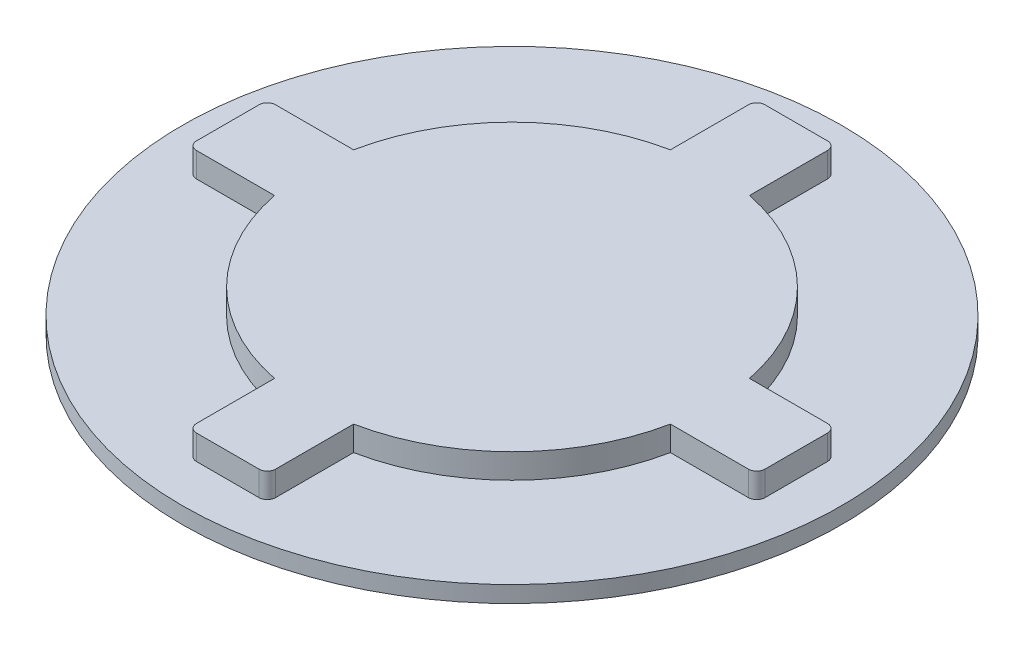
from build123d import *

# Parameters (mm, degrees)
CROQUIS5_R              = 24.5
SALIENTE_EXTRUIR3_DEPTH = 3
SALIENTE_EXTRUIR4_DEPTH = 3
CROQUIS7_R              = 40
SALIENTE_EXTRUIR5_DEPTH = 2
CORTAR_EXTRUIR3_DEPTH   = 2
CROQUIS9_R              = 2
CORTAR_EXTRUIR4_DEPTH   = 1
CROQUIS10_R             = 0.5
CORTAR_EXTRUIR5_DEPTH   = 2


with BuildPart() as part:
    # Croquis5 → Saliente-Extruir3 (new body)
    with BuildSketch(Plane(origin=(0, 0, 0), x_dir=(1, 0, 0), z_dir=(0, 1, 0))):
        Circle(CROQUIS5_R)
    extrude(amount=SALIENTE_EXTRUIR3_DEPTH)

    # Croquis6 → Saliente-Extruir4 (add)
    with BuildSketch(Plane.XZ):
        with BuildLine():
            ThreePointArc((34.5, 3.8), (34.207106781, 4.507106781), (33.5, 4.8))
            Line((33.5, 4.8), (24.025195108, 4.8))
            ThreePointArc((24.025195108, 4.8), (24.5, 0), (24.025195108, -4.8))
            Line((24.025195108, -4.8), (33.5, -4.8))
            ThreePointArc((33.5, -4.8), (34.207106781, -4.507106781), (34.5, -3.8))
            Line((34.5, -3.8), (34.5, 3.8))
        make_face()
        with BuildLine():
            ThreePointArc((-4.8, 24.025195108), (0, 24.5), (4.8, 24.025195108))
            Line((4.8, 24.025195108), (4.8, 33.5))
            ThreePointArc((4.8, 33.5), (4.507106781, 34.207106781), (3.8, 34.5))
            Line((3.8, 34.5), (-3.8, 34.5))
            ThreePointArc((-3.8, 34.5), (-4.507106781, 34.207106781), (-4.8, 33.5))
            Line((-4.8, 33.5), (-4.8, 24.025195108))
        make_face()
        with BuildLine():
            ThreePointArc((-24.025195108, -4.8), (-24.5, 0), (-24.025195108, 4.8))
            Line((-24.025195108, 4.8), (-33.5, 4.8))
            ThreePointArc((-33.5, 4.8), (-34.207106781, 4.507106781), (-34.5, 3.8))
            Line((-34.5, 3.8), (-34.5, -3.8))
            ThreePointArc((-34.5, -3.8), (-34.207106781, -4.507106781), (-33.5, -4.8))
            Line((-33.5, -4.8), (-24.025195108, -4.8))
        make_face()
        with BuildLine():
            Line((4.8, -33.5), (4.8, -24.025195108))
            ThreePointArc((4.8, -24.025195108), (0, -24.5), (-4.8, -24.025195108))
            Line((-4.8, -24.025195108), (-4.8, -33.5))
            ThreePointArc((-4.8, -33.5), (-4.507106781, -34.207106781), (-3.8, -34.5))
            Line((-3.8, -34.5), (3.8, -34.5))
            ThreePointArc((3.8, -34.5), (4.507106781, -34.207106781), (4.8, -33.5))
        make_face()
    extrude(amount=-SALIENTE_EXTRUIR4_DEPTH)

    # Croquis7 → Saliente-Extruir5 (add)
    with BuildSketch(Plane.XZ):
        Circle(CROQUIS7_R)
    extrude(amount=SALIENTE_EXTRUIR5_DEPTH)

    # Croquis8 → Cortar-Extruir3 (cut)
    with BuildSketch(Plane.XZ.offset(2)):
        with BuildLine():
            Line((-2.5, -25), (2.5, -25))
            Line((2.5, -25), (2.5, -19.843134833))
            ThreePointArc((2.5, -19.843134833), (14.142135624, -14.142135624), (19.843134833, -2.5))
            Line((19.843134833, -2.5), (25, -2.5))
            Line((25, -2.5), (25, 2.5))
            Line((25, 2.5), (19.843134833, 2.5))
            ThreePointArc((19.843134833, 2.5), (14.142135624, 14.142135624), (2.5, 19.843134833))
            Line((2.5, 19.843134833), (2.5, 25))
            Line((2.5, 25), (-2.5, 25))
            Line((-2.5, 25), (-2.5, 19.843134833))
            ThreePointArc((-2.5, 19.843134833), (-14.142135624, 14.142135624), (-19.843134833, 2.5))
            Line((-19.843134833, 2.5), (-25, 2.5))
            Line((-25, 2.5), (-25, -2.5))
            Line((-25, -2.5), (-19.843134833, -2.5))
            ThreePointArc((-19.843134833, -2.5), (-14.142135624, -14.142135624), (-2.5, -19.843134833))
            Line((-2.5, -19.843134833), (-2.5, -25))
        make_face()
        with BuildLine():
            ThreePointArc((14.790199458, -2.5), (10.606601718, -10.606601718), (2.5, -14.790199458))
            Line((2.5, -14.790199458), (2.5, -2.5))
            Line((2.5, -2.5), (14.790199458, -2.5))
        make_face(mode=Mode.SUBTRACT)
        with BuildLine():
            ThreePointArc((-2.5, -14.790199458), (-10.606601718, -10.606601718), (-14.790199458, -2.5))
            Line((-14.790199458, -2.5), (-2.5, -2.5))
            Line((-2.5, -2.5), (-2.5, -14.790199458))
        make_face(mode=Mode.SUBTRACT)
        with BuildLine():
            Line((14.790199458, 2.5), (2.5, 2.5))
            Line((2.5, 2.5), (2.5, 14.790199458))
            ThreePointArc((2.5, 14.790199458), (10.606601718, 10.606601718), (14.790199458, 2.5))
        make_face(mode=Mode.SUBTRACT)
        with BuildLine():
            ThreePointArc((-14.790199458, 2.5), (-10.606601718, 10.606601718), (-2.5, 14.790199458))
            Line((-2.5, 14.790199458), (-2.5, 2.5))
            Line((-2.5, 2.5), (-14.790199458, 2.5))
        make_face(mode=Mode.SUBTRACT)
    extrude(amount=-CORTAR_EXTRUIR3_DEPTH, mode=Mode.SUBTRACT)

    # Croquis9 → Cortar-Extruir4 (cut)
    with BuildSketch(Plane.XZ):
        Circle(CROQUIS9_R)
    extrude(amount=-CORTAR_EXTRUIR4_DEPTH, mode=Mode.SUBTRACT)

    # Croquis10 → Cortar-Extruir5 (cut)
    with BuildSketch(Plane.XZ):
        with Locations((-22.5, 0)):
            Circle(CROQUIS10_R)
        with Locations((0, 22.5)):
            Circle(CROQUIS10_R)
        with Locations((22.5, 0)):
            Circle(CROQUIS10_R)
        with Locations((0, -22.5)):
            Circle(CROQUIS10_R)
    extrude(amount=-CORTAR_EXTRUIR5_DEPTH, mode=Mode.SUBTRACT)


solid = part.part
